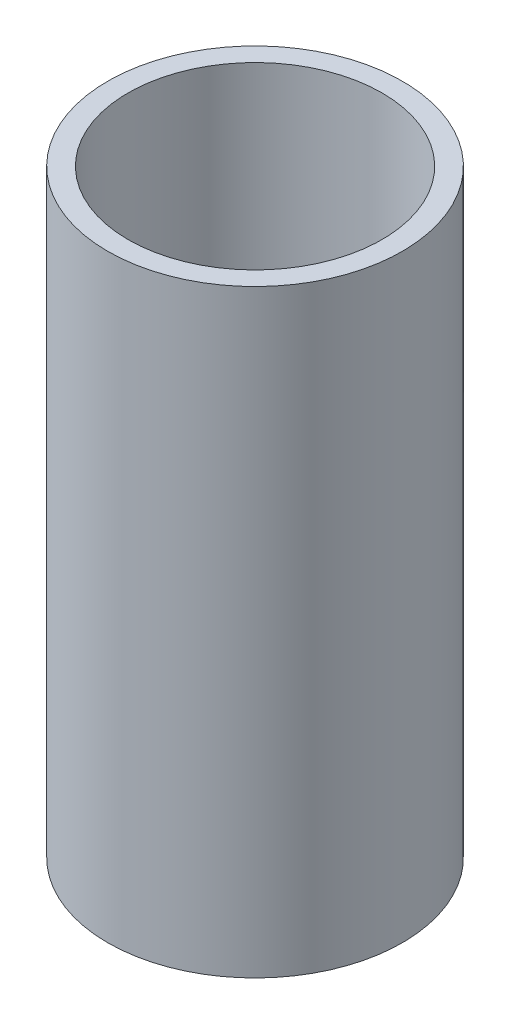
from build123d import *

# Parameters (mm, degrees)
SKETCH1_R           = 32.5
BOSS_EXTRUDE1_DEPTH = 132.079813931
SKETCH2_R           = 28.018340946
CUT_EXTRUDE1_DEPTH  = 140.8484081


with BuildPart() as part:
    # Sketch1 → Boss-Extrude1 (new body)
    with BuildSketch(Plane(origin=(0, 0, 0), x_dir=(1, 0, 0), z_dir=(0, 1, 0))):
        Circle(SKETCH1_R)
    extrude(amount=BOSS_EXTRUDE1_DEPTH)

    # Sketch2 → Cut-Extrude1 (cut, through all)
    with BuildSketch(Plane(origin=(0, 0, 0), x_dir=(1, 0, 0), z_dir=(0, 1, 0))):
        Circle(SKETCH2_R)
    extrude(amount=CUT_EXTRUDE1_DEPTH, mode=Mode.SUBTRACT)


solid = part.part
